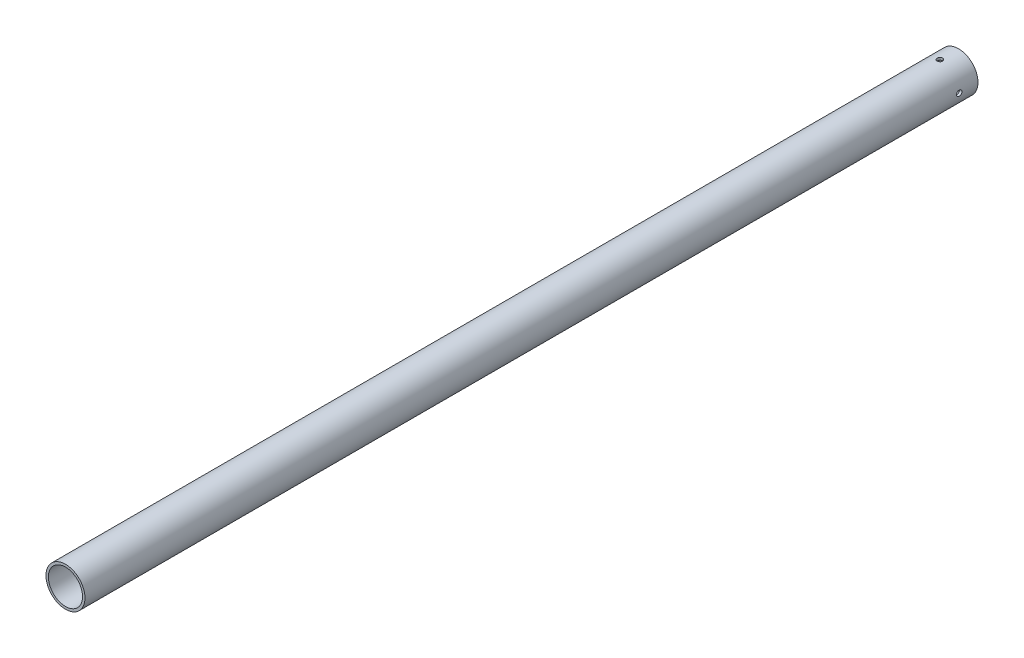
from build123d import *

# Parameters (mm, degrees)
SKETCH2_R               = 12.7
SKETCH2_R_2             = 11.1125
BOSS_EXTRUDE1_DEPTH     = 290.609629981
CUT_EXTRUDE1_DEPTH      = 292.164106713
CUT_EXTRUDE1_DEPTH_BACK = 292.164106713
SKETCH3_R               = 1.7526
CUT_EXTRUDE2_DEPTH      = 292.164106822
CUT_EXTRUDE2_DEPTH_BACK = 292.164106822
SKETCH5_R               = 1.7526


with BuildPart() as part:
    # Sketch2 → Boss-Extrude1 (new, symmetric)
    with BuildSketch(Plane.XY):
        Circle(SKETCH2_R)
        Circle(SKETCH2_R_2, mode=Mode.SUBTRACT)
    extrude(amount=BOSS_EXTRUDE1_DEPTH, both=True)

    # Sketch3 → Cut-Extrude1 (cut, two sides: drawn at the far end of the back side and taken through both)
    with BuildSketch(Plane(origin=(0, 0, 0), x_dir=(1, 0, 0), z_dir=(0, 1, 0)).offset(-CUT_EXTRUDE1_DEPTH_BACK)):
        with Locations((0, 278.417629981)):
            Circle(SKETCH3_R)
    extrude(amount=CUT_EXTRUDE1_DEPTH + CUT_EXTRUDE1_DEPTH_BACK, mode=Mode.SUBTRACT)

    # Sketch5 → Cut-Extrude2 (cut, two sides: drawn at the far end of the back side and taken through both)
    with BuildSketch(Plane(origin=(0, 0, 0), x_dir=(0, 0, -1), z_dir=(1, 0, 0)).offset(-CUT_EXTRUDE2_DEPTH_BACK)):
        with Locations((278.417629981, 0)):
            Circle(SKETCH5_R)
    extrude(amount=CUT_EXTRUDE2_DEPTH + CUT_EXTRUDE2_DEPTH_BACK, mode=Mode.SUBTRACT)


solid = part.part
